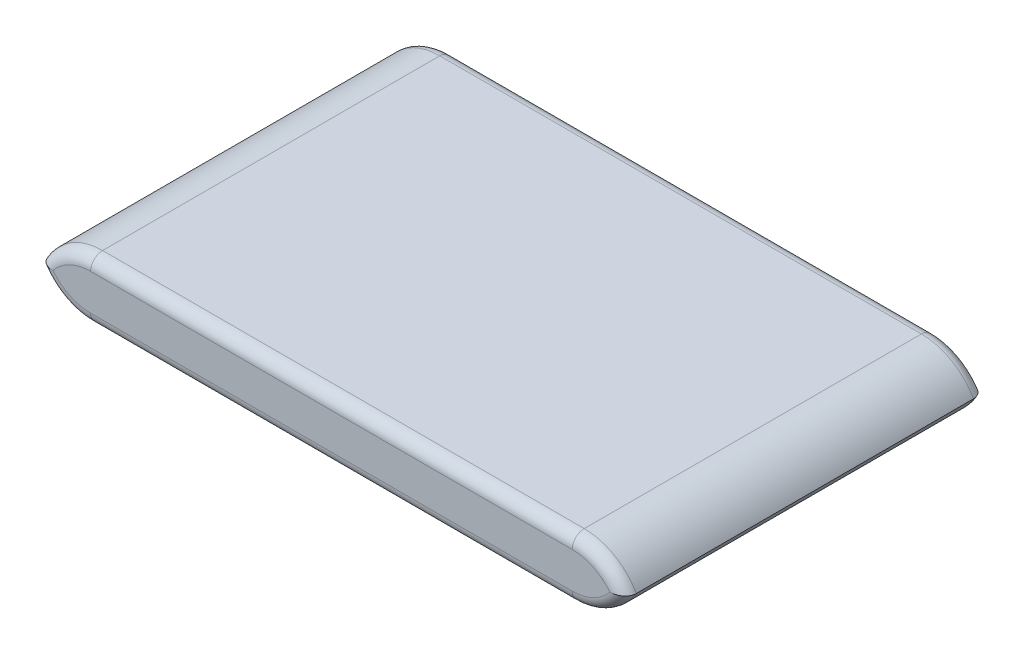
from build123d import *

# Parameters (mm, degrees)
SKETCH1_W           = 50
SKETCH1_H           = 30
BOSS_EXTRUDE1_DEPTH = 5
FILLET1_R           = 5
FILLET2_R           = 1


with BuildPart() as part:
    # Sketch1 → Boss-Extrude1 (new body)
    with BuildSketch(Plane(origin=(0, 0, 0), x_dir=(1, 0, 0), z_dir=(0, 1, 0))):
        Rectangle(SKETCH1_W, SKETCH1_H)
    extrude(amount=BOSS_EXTRUDE1_DEPTH)

    # Fillet1
    # the kernel refuses this fillet: 5 mm, written as the material it takes off along each edge
    with BuildSketch(Plane(origin=(-25, 0, 27.5), x_dir=(0, 1, 0), z_dir=(0, 0, -1)), Plane(origin=(25, 0, -27.5), x_dir=(0, 1, 0), z_dir=(0, 0, 1))) as fillet1_piece_1:
        with BuildLine():
            CenterArc((FILLET1_R, FILLET1_R), FILLET1_R, 180, 90)
            Line((0, FILLET1_R), (0, 0))
            Line((0, 0), (FILLET1_R, 0))
        make_face()
    extrude(amount=55, mode=Mode.SUBTRACT)
    with BuildSketch(Plane(origin=(-25, 5, 27.5), x_dir=(0, -1, 0), z_dir=(0, 0, -1)), Plane(origin=(25, 5, -27.5), x_dir=(0, -1, 0), z_dir=(0, 0, 1))) as fillet1_piece_2:
        with BuildLine():
            CenterArc((FILLET1_R, -FILLET1_R), FILLET1_R, 90, 90)
            Line((0, -FILLET1_R), (0, 0))
            Line((0, 0), (FILLET1_R, 0))
        make_face()
    extrude(amount=55, mode=Mode.SUBTRACT)

    # Fillet2
    fillet2_edges = [part.edges().sort_by_distance(p)[0] for p in [
        (0, 0, 15),
        (0, 5, 15),
        (22.5, 4.330127019, 15),
        (22.5, 0.669872981, 15),
        (-22.5, 4.330127019, 15),
        (-22.5, 0.669872981, 15),
        (0, 0, -15),
        (0, 5, -15),
        (22.5, 4.330127019, -15),
        (22.5, 0.669872981, -15),
        (-22.5, 4.330127019, -15),
        (-22.5, 0.669872981, -15),
    ]]
    fillet(fillet2_edges, radius=FILLET2_R)


solid = part.part
